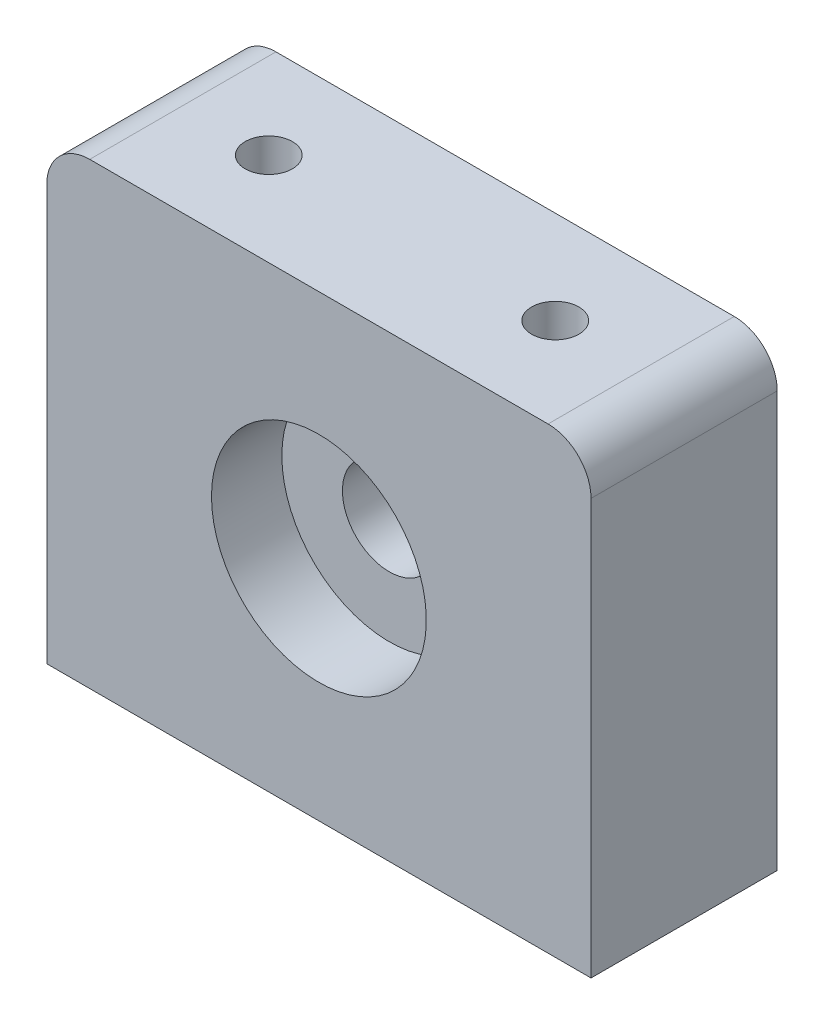
from build123d import *

# Parameters (mm, degrees)
SKETCH1_R                 = 7.5
BOSS_EXTRUDE1_DEPTH       = 13
BOSS_EXTRUDE2_DEPTH       = 1.5875
BOSS_EXTRUDE2_DEPTH_BACK  = 1.5875
SKETCH3_R                 = 8.7376
SKETCH3_R_2               = 3.27025
M4X0_7_TAPPED_HOLE1_D     = 3.3
M4X0_7_TAPPED_HOLE1_DEPTH = 10.1092
M4X0_7_TAPPED_HOLE1_TIP   = 0.991420021
M4X0_7_TAPPED_HOLE2_D     = 3.3
M4X0_7_TAPPED_HOLE2_DEPTH = 10
M4X0_7_TAPPED_HOLE2_TIP   = 0.991420021


with BuildPart() as part:
    # Sketch1 → Boss-Extrude1 (new body)
    with BuildSketch(Plane.XY):
        with BuildLine():
            Line((-16, 32), (16, 32))
            ThreePointArc((16, 32), (18.121320344, 31.121320344), (19, 29))
            Line((19, 29), (19, 0))
            Line((19, 0), (0, 0))
            Line((0, 0), (-19, 0))
            Line((-19, 0), (-19, 29))
            ThreePointArc((-19, 29), (-18.121320344, 31.121320344), (-16, 32))
        make_face()
        with Locations((0, 15.874)):
            Circle(SKETCH1_R, mode=Mode.SUBTRACT)
    extrude(amount=BOSS_EXTRUDE1_DEPTH)

    # Sketch3 → Boss-Extrude2 (add, two sides: drawn at the far end of the back side and taken through both)
    with BuildSketch(Plane.XY.offset(6.5).offset(-BOSS_EXTRUDE2_DEPTH_BACK)):
        with Locations((0, 15.874)):
            Circle(SKETCH3_R)
        with Locations((0, 15.874)):
            Circle(SKETCH3_R_2, mode=Mode.SUBTRACT)
    extrude(amount=BOSS_EXTRUDE2_DEPTH + BOSS_EXTRUDE2_DEPTH_BACK)

    # M4x0.7 Tapped Hole1
    with Locations(Plane(origin=(0, 0, 0), x_dir=(-1, 0, 0), z_dir=(0, -1, 0))):
        with Locations((10, -6.5), (-10, -6.5)):
            Hole(M4X0_7_TAPPED_HOLE1_D / 2, depth=M4X0_7_TAPPED_HOLE1_DEPTH)
            with Locations((0, 0, -(M4X0_7_TAPPED_HOLE1_DEPTH + M4X0_7_TAPPED_HOLE1_TIP / 2))):  # 118° drill point
                Cone(0, M4X0_7_TAPPED_HOLE1_D / 2, M4X0_7_TAPPED_HOLE1_TIP, mode=Mode.SUBTRACT)

    # M4x0.7 Tapped Hole2
    with Locations(Plane(origin=(0, 32, 0), x_dir=(1, 0, 0), z_dir=(0, 1, 0))):
        with Locations((-10, -6.5), (10, -6.5)):
            Hole(M4X0_7_TAPPED_HOLE2_D / 2, depth=M4X0_7_TAPPED_HOLE2_DEPTH)
            with Locations((0, 0, -(M4X0_7_TAPPED_HOLE2_DEPTH + M4X0_7_TAPPED_HOLE2_TIP / 2))):  # 118° drill point
                Cone(0, M4X0_7_TAPPED_HOLE2_D / 2, M4X0_7_TAPPED_HOLE2_TIP, mode=Mode.SUBTRACT)


solid = part.part
